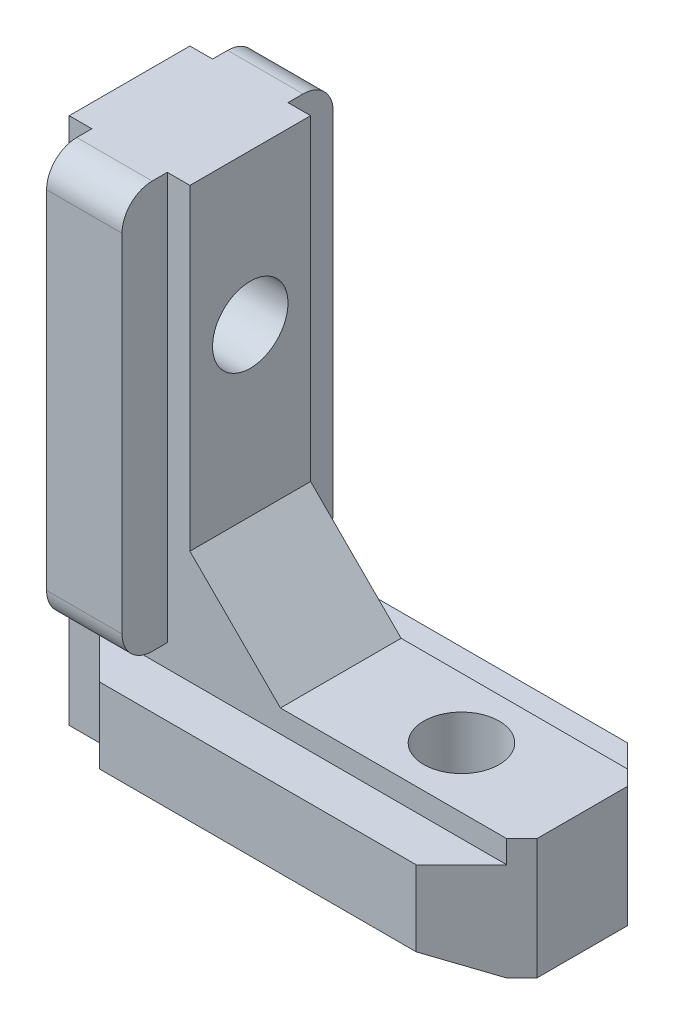
from build123d import *

# Parameters (mm, degrees)
BOSS_EXTRUDE1_DEPTH = 4
BOSS_EXTRUDE2_DEPTH = 29
CHAMFER1_SIZE       = 4
CHAMFER2_SIZE       = 6
CUT_EXTRUDE1_REACH  = 48.626
SKETCH3_R           = 2.5
CUT_EXTRUDE2_REACH  = 48.626
SKETCH4_R           = 2.5
SKETCH5_W           = 5
SKETCH5_H           = 3
BOSS_EXTRUDE3_DEPTH = 27
FILLET1_R           = 2


with BuildPart() as part:
    # Sketch1 → Boss-Extrude1 (new, symmetric)
    with BuildSketch(Plane.XY):
        Polygon((0, 0), (0, 35), (8, 35), (8, 8), (30, 8), (30, 0), align=None)
    extrude(amount=BOSS_EXTRUDE1_DEPTH, both=True)

    # Sketch2 → Boss-Extrude2 (add)
    with BuildSketch(Plane(origin=(30, 0, 0), x_dir=(0, 0, -1), z_dir=(1, 0, 0))):
        Polygon((-4, 6.5), (-7, 6.5), (-7, 1.5), (-4, 0), align=None)
        Polygon((4, 0), (4, 6.5), (7, 6.5), (7, 1.5), align=None)
    extrude(amount=-BOSS_EXTRUDE2_DEPTH)

    # Chamfer1
    # the kernel refuses this chamfer: 4 mm, written as the material it takes off along each edge
    with BuildSketch(Plane(origin=(30, 16.786731952, -7), x_dir=(0.027495876610586487, 0, 0.9996219169112968), z_dir=(0, -1, 0))) as chamfer1_piece_1:
        Polygon((CHAMFER1_SIZE * 0.999621916911, CHAMFER1_SIZE * 0.0274958766106), (-CHAMFER1_SIZE * 0.0274958766106, CHAMFER1_SIZE * 0.999621916911), (0, 0), align=None)
    extrude(amount=25.573463904, mode=Mode.SUBTRACT)
    with BuildSketch(Plane(origin=(1, 16.786731952, -7), x_dir=(-0.02749587661058638, 0, 0.9996219169112968), z_dir=(0, -1, 0))) as chamfer1_piece_2_section:
        Polygon((CHAMFER1_SIZE * 0.999621916911, -CHAMFER1_SIZE * 0.0274958766106), (-CHAMFER1_SIZE * 0.0274958766106, -CHAMFER1_SIZE * 0.999621916911), (0, 0), align=None)
    chamfer1_piece_2 = extrude(amount=25.573463904, mode=Mode.PRIVATE)
    chamfer1_piece_2 = split(chamfer1_piece_2, bisect_by=Plane(origin=(2.407836441, 4, -4), z_dir=(0, 0, -1)), keep=Keep.TOP, mode=Mode.PRIVATE)
    add(chamfer1_piece_2, mode=Mode.SUBTRACT)
    with BuildSketch(Plane(origin=(30, 16.786731952, 7), x_dir=(0.027495876610586487, 0, -0.9996219169112968), z_dir=(0, -1, 0))) as chamfer1_piece_3:
        Polygon((CHAMFER1_SIZE * 0.999621916911, -CHAMFER1_SIZE * 0.0274958766106), (-CHAMFER1_SIZE * 0.0274958766106, -CHAMFER1_SIZE * 0.999621916911), (0, 0), align=None)
    extrude(amount=25.573463904, mode=Mode.SUBTRACT)
    with BuildSketch(Plane(origin=(1, 16.786731952, 7), x_dir=(-0.02749587661058638, 0, -0.9996219169112968), z_dir=(0, -1, 0))) as chamfer1_piece_4_section:
        Polygon((CHAMFER1_SIZE * 0.999621916911, CHAMFER1_SIZE * 0.0274958766106), (-CHAMFER1_SIZE * 0.0274958766106, CHAMFER1_SIZE * 0.999621916911), (0, 0), align=None)
    chamfer1_piece_4 = extrude(amount=25.573463904, mode=Mode.PRIVATE)
    chamfer1_piece_4 = split(chamfer1_piece_4, bisect_by=Plane(origin=(2.407836441, 4, 4), z_dir=(0, 0, 1)), keep=Keep.TOP, mode=Mode.PRIVATE)
    add(chamfer1_piece_4, mode=Mode.SUBTRACT)

    # Chamfer2
    chamfer2_edges = [part.edges().sort_by_distance(p)[0] for p in [
        (8, 8, 0),
    ]]
    chamfer(chamfer2_edges, length=CHAMFER2_SIZE)

    # Sketch3 → Cut-Extrude1 (cut, up to next)
    with BuildSketch(Plane.XZ, mode=Mode.PRIVATE) as cut_extrude1_sk1:
        with Locations((22, 0)):
            Circle(SKETCH3_R)
    cut_extrude1_tool1 = extrude(cut_extrude1_sk1.sketch, amount=-CUT_EXTRUDE1_REACH, mode=Mode.PRIVATE) & part.part
    add(cut_extrude1_tool1.solids().sort_by_distance((22, 0, 0))[0], mode=Mode.SUBTRACT)

    # Sketch4 → Cut-Extrude2 (cut, up to next)
    with BuildSketch(Plane.ZY, mode=Mode.PRIVATE) as cut_extrude2_sk1:
        with Locations((0, 25)):
            Circle(SKETCH4_R)
    cut_extrude2_tool1 = extrude(cut_extrude2_sk1.sketch, amount=-CUT_EXTRUDE2_REACH, mode=Mode.PRIVATE) & part.part
    add(cut_extrude2_tool1.solids().sort_by_distance((0, 25, 0))[0], mode=Mode.SUBTRACT)

    # Sketch5 → Boss-Extrude3 (add)
    with BuildSketch(Plane(origin=(0, 35, 0), x_dir=(1, 0, 0), z_dir=(0, 1, 0))):
        with Locations((4, 5.5)):
            Rectangle(SKETCH5_W, SKETCH5_H)
        with Locations((4, -5.5)):
            Rectangle(SKETCH5_W, SKETCH5_H)
    extrude(amount=-BOSS_EXTRUDE3_DEPTH)

    # Fillet1
    fillet1_edges = [part.edges().sort_by_distance(p)[0] for p in [
        (4, 8, -7),
        (4, 35, -7),
        (4, 8, 7),
        (4, 35, 7),
    ]]
    fillet(fillet1_edges, radius=FILLET1_R)


solid = part.part
